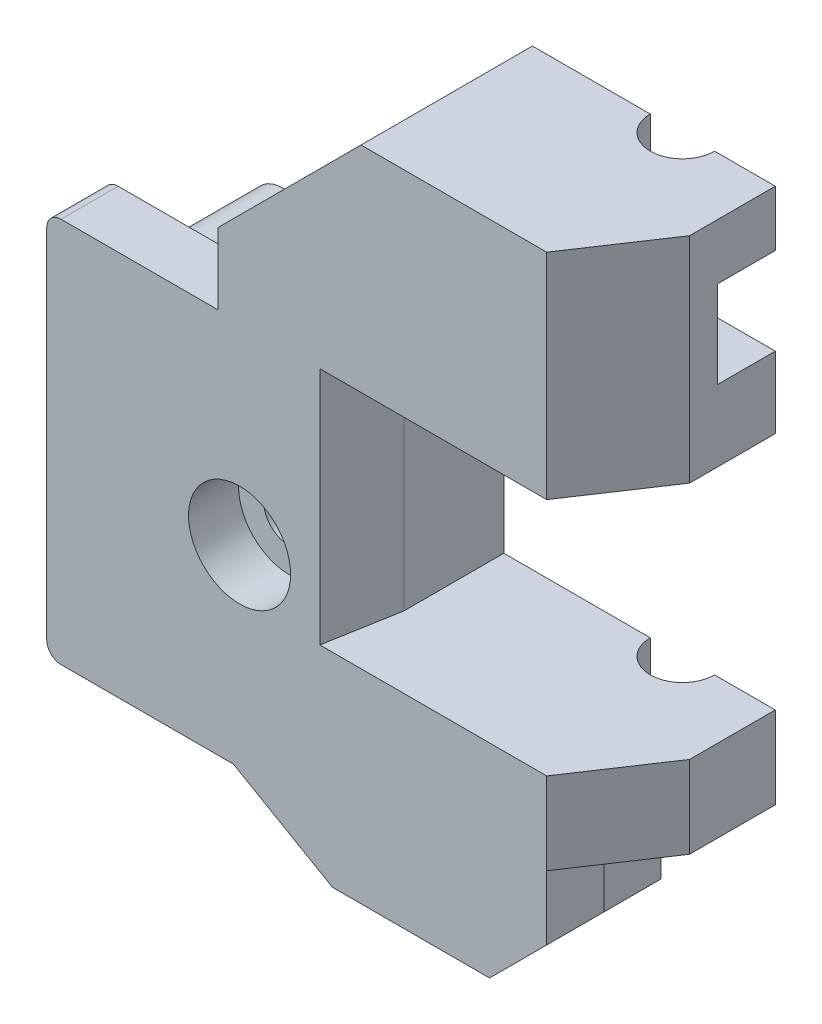
from build123d import *

# Parameters (mm, degrees)
BOSS_EXTRUDE1_DEPTH                            = 4
SKETCH3_R                                      = 2.15
BOSS_EXTRUDE2_DEPTH                            = 8
BOSS_EXTRUDE3_START                            = -8
BOSS_EXTRUDE3_DEPTH                            = 8
CBORE_FOR_6_SOCKET_HEAD_CAP_SCREW1_D           = 3.6576
CBORE_FOR_6_SOCKET_HEAD_CAP_SCREW1_CBORE_D     = 7.14502
CBORE_FOR_6_SOCKET_HEAD_CAP_SCREW1_CBORE_DEPTH = 3.5052
BOSS_EXTRUDE5_DEPTH                            = 15
BOSS_EXTRUDE6_DEPTH                            = 5.75
CUT_EXTRUDE1_DEPTH                             = 49.104053883
CUT_EXTRUDE1_DEPTH_BACK                        = 20
SKETCH11_5_R                                   = 2.25
CUT_EXTRUDE2_DEPTH                             = 6.1
CHAMFER2_SIZE                                  = 10
SKETCH18_R                                     = 2
BOSS_EXTRUDE10_DEPTH                           = 2
CHAMFER3_SIZE                                  = 5
CHAMFER3_SIZE2                                 = 0.881634904
BOSS_EXTRUDE7_DEPTH                            = 4
BOSS_EXTRUDE9_DEPTH                            = 8


with BuildPart() as part:
    # Sketch2 → Boss-Extrude1 (new body)
    with BuildSketch(Plane.XY):
        with BuildLine():
            Line((1, 0), (20, 0))
            Line((20, 0), (20, 27))
            Line((20, 27), (1, 27))
            ThreePointArc((1, 27), (0.292893219, 26.707106781), (0, 26))
            Line((0, 26), (0, 1))
            ThreePointArc((0, 1), (0.292893219, 0.292893219), (1, 0))
        make_face()
    extrude(amount=BOSS_EXTRUDE1_DEPTH)

    # Sketch3 → Boss-Extrude2 (add)
    with BuildSketch(Plane.XY):
        with Locations((4.5, 22.5)):
            Circle(SKETCH3_R)
        with Locations((4.5, 4.5)):
            Circle(SKETCH3_R)
    extrude(amount=-BOSS_EXTRUDE2_DEPTH)

    # Sketch3<3> → Boss-Extrude3 (add)
    with BuildSketch(Plane.XY.offset(BOSS_EXTRUDE3_START)):
        with BuildLine():
            Line((4.5, 15), (4.5, 12))
            ThreePointArc((4.5, 12), (8.782801805, 10.656915518), (11.531693039, 7.108695652))
            ThreePointArc((11.531693039, 7.108695652), (12.997768364, 5.216311724), (15.281929326, 4.5))
            Line((15.281929326, 4.5), (20, 4.5))
            Line((20, 4.5), (20, 27))
            Line((20, 27), (12, 27))
            Line((12, 27), (12, 22.5))
            ThreePointArc((12, 22.5), (9.803300859, 17.196699141), (4.5, 15))
        make_face()
    extrude(amount=BOSS_EXTRUDE3_DEPTH)

    # CBORE for #6 Socket Head Cap Screw1 (through all)
    with Locations(Plane.XY.offset(4)):
        with Locations((13.5, 13.5)):
            CounterBoreHole(CBORE_FOR_6_SOCKET_HEAD_CAP_SCREW1_D / 2, CBORE_FOR_6_SOCKET_HEAD_CAP_SCREW1_CBORE_D / 2, CBORE_FOR_6_SOCKET_HEAD_CAP_SCREW1_CBORE_DEPTH)

    # Sketch11 → Boss-Extrude5 (add)
    with BuildSketch(Plane(origin=(0, 27, 0), x_dir=(1, 0, 0), z_dir=(0, 1, 0))):
        Polygon((12, 8), (12, -4), (35, -4), (39, 2), (39, 8), align=None)
    extrude(amount=BOSS_EXTRUDE5_DEPTH)

    # Sketch13 → Boss-Extrude6 (add)
    with BuildSketch(Plane(origin=(0, 10.25, 0), x_dir=(-1, 0, 0), z_dir=(0, -1, 0))):
        Polygon((-20, -4), (-20, 8), (-39, 8), (-39, 2), (-35, -4), align=None)
    extrude(amount=BOSS_EXTRUDE6_DEPTH)

    # Sketch11<5> → Cut-Extrude1 (cut, two sides: drawn at the far end of the back side and taken through both)
    with BuildSketch(Plane(origin=(0, 27, 0), x_dir=(1, 0, 0), z_dir=(0, 1, 0)).offset(-CUT_EXTRUDE1_DEPTH_BACK)):
        with Locations((32.5, 8)):
            Circle(SKETCH11_5_R)
    extrude(amount=CUT_EXTRUDE1_DEPTH + CUT_EXTRUDE1_DEPTH_BACK, mode=Mode.SUBTRACT)

    # Sketch14 → Cut-Extrude2 (cut)
    with BuildSketch(Plane(origin=(0, 32, 0), x_dir=(-1, 0, 0), z_dir=(0, -1, 0))):
        with BuildLine():
            Line((-29.85, 14.55), (-29.85, 1.45))
            Line((-29.85, 1.45), (-28.547785431, 1.45))
            ThreePointArc((-28.547785431, 1.45), (-25.8382832, 4.239145141), (-24.85, 8))
            ThreePointArc((-24.85, 8), (-25.8382832, 11.760854859), (-28.547785431, 14.55))
            Line((-28.547785431, 14.55), (-29.85, 14.55))
        make_face()
        with BuildLine():
            Line((-28.547785431, 1.45), (-29.85, 1.45))
            Line((-29.85, 1.45), (-29.85, 14.55))
            Line((-29.85, 14.55), (-28.547785431, 14.55))
            ThreePointArc((-28.547785431, 14.55), (-40.15, 8), (-28.547785431, 1.45))
        make_face()
        with BuildLine():
            ThreePointArc((-24.85, 8), (-25.8382832, 4.239145141), (-28.547785431, 1.45))
            Line((-28.547785431, 1.45), (-24.85, 1.45))
            Line((-24.85, 1.45), (-24.85, 8))
        make_face()
        Polygon((-24.85, 8), (-24.85, 1.45), (-9.85, 1.45), (-9.85, 14.55), (-24.85, 14.55), align=None)
        with BuildLine():
            Line((-24.85, 14.55), (-28.547785431, 14.55))
            ThreePointArc((-28.547785431, 14.55), (-25.8382832, 11.760854859), (-24.85, 8))
            Line((-24.85, 8), (-24.85, 14.55))
        make_face()
    extrude(amount=-CUT_EXTRUDE2_DEPTH, mode=Mode.SUBTRACT)

    # Chamfer2
    chamfer2_edges = [part.edges().sort_by_distance(p)[0] for p in [
        (12, 42, -2),
    ]]
    chamfer(chamfer2_edges, length=CHAMFER2_SIZE)

    # Sketch18 → Boss-Extrude10 (add)
    with BuildSketch(Plane(origin=(0, 0, -8), x_dir=(-1, 0, 0), z_dir=(0, 0, -1))):
        with Locations(Location((-16, 26, 0), (0, 0, 180))):
            Circle(SKETCH18_R)
    extrude(amount=BOSS_EXTRUDE10_DEPTH)

    # Chamfer3
    chamfer3_edges = [part.edges().sort_by_distance(p)[0] for p in [
        (20, 18.625, 4),
    ]]
    chamfer3_side = [part.faces().sort_by_distance(p)[0] for p in [
        (20, 18.625, -2),
    ]]
    chamfer(chamfer3_edges, length=CHAMFER3_SIZE, length2=CHAMFER3_SIZE2, reference=chamfer3_side[0])

    # Sketch15 → Boss-Extrude7 (add)
    with BuildSketch(Plane.XY.offset(4)):
        Polygon((20, 4.5), (20, 0), (13.07179677, 0), (20, -4), (31, -4), (35, 0), (35, 4.5), align=None)
    extrude(amount=-BOSS_EXTRUDE7_DEPTH)

    # Sketch17 → Boss-Extrude9 (add)
    with BuildSketch(Plane(origin=(0, 0, 0), x_dir=(-1, 0, 0), z_dir=(0, 0, -1))):
        with BuildLine():
            Line((-30.25, 0), (-15.870834875, 0))
            ThreePointArc((-15.870834875, 0), (-15.146390506, -0.555885716), (-15.495834875, -1.399519053))
            Line((-15.495834875, -1.399519053), (-20, -4))
            Line((-20, -4), (-31, -4))
            Line((-31, -4), (-31, -0.75))
            ThreePointArc((-31, -0.75), (-30.780330086, -0.219669914), (-30.25, 0))
        make_face()
    extrude(amount=BOSS_EXTRUDE9_DEPTH)


solid = part.part
